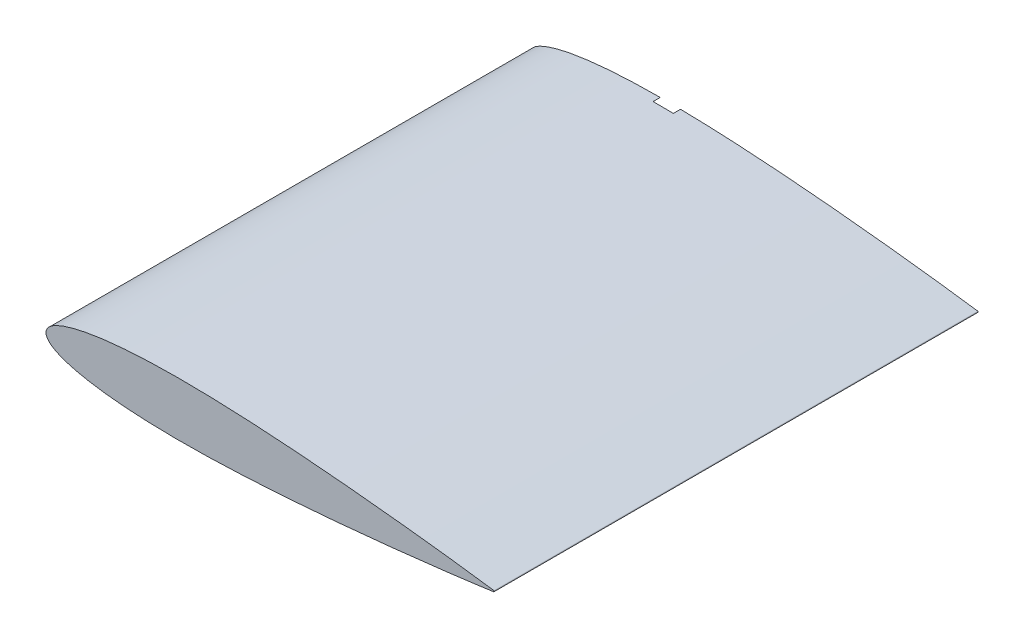
from build123d import *

# Parameters (mm, degrees)
BOSS_EXTRUDE1_DEPTH = 54
SKETCH3_R           = 0.75
SKETCH3_R_2         = 3.2
CUT_EXTRUDE1_DEPTH  = 0.8
SKETCH4_R           = 2.25
CUT_EXTRUDE2_DEPTH  = 2
MOVE_FACE1_BY       = 9
MOVE_FACE1_2_BY     = 9
SKETCH5_R           = 0.75
CUT_EXTRUDE3_DEPTH  = 10


with BuildPart() as part:
    # Sketch2 → Boss-Extrude1 (new body)
    with BuildSketch(Plane.XY):
        with BuildLine():
            add(Edge.make_bspline(
                [(50, 0), (50, 0.026917877), (49.976391994, 0.086335653), (49.858591467, 0.072753496), (49.720861566, 0.106690064), (49.514192254, 0.128990689), (49.255018216, 0.167243525), (48.937405374, 0.210008577), (48.564512057, 0.261101422), (48.136362116, 0.318689664), (47.654258127, 0.383031225), (47.11922683, 0.453500426), (46.532544587, 0.529818165), (45.89556023, 0.611355732), (45.209774552, 0.697911858), (44.476783304, 0.788879478), (43.698305339, 0.88378855), (42.876164458, 0.982215285), (42.012275292, 1.083645419), (41.108623744, 1.187471329), (40.167371761, 1.293427862), (39.190688126, 1.400754935), (38.180884893, 1.509164292), (37.140280944, 1.617881218), (36.071329195, 1.726704247), (34.976513091, 1.834794235), (33.85840685, 1.941811697), (32.71960692, 2.047013351), (31.562769841, 2.150055251), (30.390604536, 2.250085566), (29.205842614, 2.346656872), (28.011266123, 2.439152447), (26.809649805, 2.526829784), (25.603817509, 2.609138979), (24.396584079, 2.68542256), (23.190743882, 2.754943805), (21.989135564, 2.817152938), (20.794538102, 2.87137081), (19.609751293, 2.916993444), (18.437559964, 2.953514341), (17.280693227, 2.980283873), (16.141851879, 2.996830119), (15.023668017, 3.002688022), (13.928775138, 2.997509495), (12.859735704, 2.981061709), (11.819054817, 2.952847595), (10.809139833, 2.912992008), (9.832347257, 2.861208574), (8.890951187, 2.797642436), (7.987168397, 2.722306849), (7.123100129, 2.635338734), (6.300754072, 2.537068004), (5.522026056, 2.4278941), (4.78875058, 2.308020534), (4.102608172, 2.178046413), (3.465177977, 2.038460459), (2.877949722, 1.889735855), (2.342220998, 1.732538863), (1.859173086, 1.567391533), (1.429836113, 1.394864248), (1.05505997, 1.215454715), (0.735558654, 1.029536458), (0.471704213, 0.837424644), (0.264006483, 0.63880326), (0.112966335, 0.433109644), (0.020620149, 0.219338391), (-0.010051124, 0), (0.020620149, -0.219338391), (0.112966335, -0.433109644), (0.264006483, -0.63880326), (0.471704213, -0.837424644), (0.735558654, -1.029536458), (1.05505997, -1.215454715), (1.429836113, -1.394864248), (1.859173086, -1.567391533), (2.342220998, -1.732538863), (2.877949722, -1.889735855), (3.465177977, -2.038460459), (4.102608172, -2.178046413), (4.78875058, -2.308020534), (5.522026056, -2.4278941), (6.300754072, -2.537068004), (7.123100129, -2.635338734), (7.987168397, -2.722306849), (8.890951187, -2.797642436), (9.832347257, -2.861208574), (10.809139833, -2.912992008), (11.819054817, -2.952847595), (12.859735704, -2.981061709), (13.928775138, -2.997509495), (15.023668017, -3.002688022), (16.141851879, -2.996830119), (17.280693227, -2.980283873), (18.437559964, -2.953514341), (19.609751293, -2.916993444), (20.794538102, -2.87137081), (21.989135564, -2.817152938), (23.190743882, -2.754943805), (24.396584079, -2.68542256), (25.603817509, -2.609138979), (26.809649805, -2.526829784), (28.011266123, -2.439152447), (29.205842614, -2.346656872), (30.390604536, -2.250085566), (31.562769841, -2.150055251), (32.71960692, -2.047013351), (33.85840685, -1.941811697), (34.976513091, -1.834794235), (36.071329195, -1.726704247), (37.140280944, -1.617881218), (38.180884893, -1.509164292), (39.190688126, -1.400754935), (40.167371761, -1.293427862), (41.108623744, -1.187471329), (42.012275292, -1.083645419), (42.876164458, -0.982215285), (43.698305339, -0.88378855), (44.476783304, -0.788879478), (45.209774552, -0.697911858), (45.89556023, -0.611355732), (46.532544587, -0.529818165), (47.11922683, -0.453500426), (47.654258127, -0.383031225), (48.136362116, -0.318689664), (48.564512057, -0.261101422), (48.937405374, -0.210008577), (49.255018216, -0.167243525), (49.514192254, -0.128990689), (49.720861566, -0.106690064), (49.858591467, -0.072753496), (49.976391994, -0.086335653), (50, -0.026917877), (50, 0)],
                knots=[0, 0, 0, 0, 0.000717113, 0.001582936, 0.003024104, 0.005036532, 0.007615517, 0.010755102, 0.014447541, 0.018684125, 0.023454272, 0.02874679, 0.034549036, 0.040847278, 0.047626038, 0.054870145, 0.062561521, 0.070681673, 0.079212545, 0.088133118, 0.097422551, 0.10705882, 0.117019103, 0.127279946, 0.137817628, 0.148607217, 0.159622486, 0.170838599, 0.182228878, 0.193766502, 0.205423834, 0.217174697, 0.228990438, 0.240843511, 0.252706879, 0.264552078, 0.276352251, 0.288079621, 0.299707515, 0.311208896, 0.322556837, 0.333726537, 0.344692372, 0.355429864, 0.365914697, 0.376123739, 0.386034974, 0.395627112, 0.4048795, 0.413772713, 0.422288045, 0.430408916, 0.438119055, 0.445403696, 0.452250296, 0.458647009, 0.464584397, 0.470055514, 0.47505628, 0.479586637, 0.483650869, 0.487261181, 0.490439532, 0.493224635, 0.49567779, 0.497893174, 0.5, 0.502106826, 0.50432221, 0.506775365, 0.509560468, 0.512738819, 0.516349131, 0.520413363, 0.52494372, 0.529944486, 0.535415603, 0.541352991, 0.547749704, 0.554596304, 0.561880945, 0.569591084, 0.577711955, 0.586227287, 0.5951205, 0.604372888, 0.613965026, 0.623876261, 0.634085303, 0.644570136, 0.655307628, 0.666273463, 0.677443163, 0.688791104, 0.700292485, 0.711920379, 0.723647749, 0.735447922, 0.747293121, 0.759156489, 0.771009562, 0.782825303, 0.794576166, 0.806233498, 0.817771122, 0.829161401, 0.840377514, 0.851392783, 0.862182372, 0.872720054, 0.882980897, 0.89294118, 0.902577449, 0.911866882, 0.920787455, 0.929318327, 0.937438479, 0.945129855, 0.952373962, 0.959152722, 0.965450964, 0.97125321, 0.976545728, 0.981315875, 0.985552459, 0.989244898, 0.992384483, 0.994963468, 0.996975896, 0.998417064, 0.999282887, 1, 1, 1, 1], degree=3))
        make_face()
    extrude(amount=BOSS_EXTRUDE1_DEPTH)

    # Sketch3 → Cut-Extrude1 (cut)
    with BuildSketch(Plane(origin=(0, 0, 0), x_dir=(-1, 0, 0), z_dir=(0, 0, -1))):
        with Locations((-3.658655892, 0)):
            Circle(SKETCH3_R)
        with Locations((-15.658655892, 0)):
            Circle(SKETCH3_R_2)
        with Locations((-27.658655892, 0)):
            Circle(SKETCH3_R)
    extrude(amount=-CUT_EXTRUDE1_DEPTH, mode=Mode.SUBTRACT)

    # Sketch4 → Cut-Extrude2 (cut)
    with BuildSketch(Plane(origin=(0, 0, 0.8), x_dir=(-1, 0, 0), z_dir=(0, 0, -1))):
        with Locations((-15.658655892, 0)):
            Circle(SKETCH4_R)
    extrude(amount=-CUT_EXTRUDE2_DEPTH, mode=Mode.SUBTRACT)

    # Move Face1: a face moved inward by 9.0
    extrude(part.faces().sort_by_distance((3.658655892, 0, 0.8))[0], amount=MOVE_FACE1_BY, dir=(0, 0, 1), mode=Mode.SUBTRACT)

    # Move Face1 2: a face moved inward by 9.0
    extrude(part.faces().sort_by_distance((27.658655892, 0, 0.8))[0], amount=MOVE_FACE1_2_BY, dir=(0, 0, 1), mode=Mode.SUBTRACT)

    # Sketch5 → Cut-Extrude3 (cut)
    with BuildSketch(Plane.XY):
        with Locations((25.658655892, 0)):
            Circle(SKETCH5_R)
        with Locations((23.658655892, 0)):
            Circle(SKETCH5_R)
        with Locations((7.658655892, 0)):
            Circle(SKETCH5_R)
        with Locations((5.658655892, 0)):
            Circle(SKETCH5_R)
    extrude(amount=CUT_EXTRUDE3_DEPTH, mode=Mode.SUBTRACT)


solid = part.part
